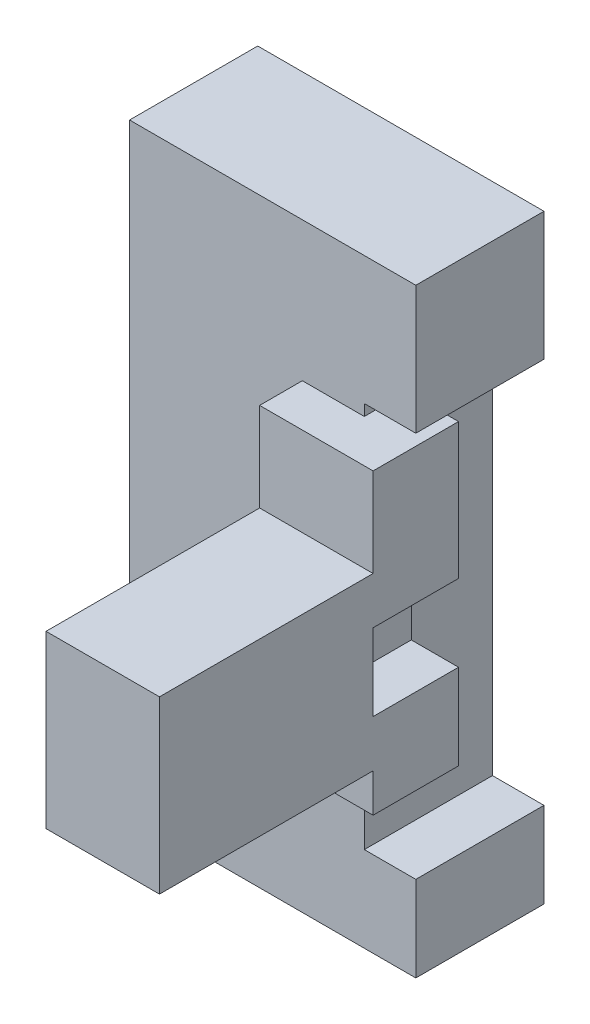
from build123d import *

# Parameters (mm, degrees)
SALIENTE_EXTRUIR1_DEPTH      = 2
CROQUIS2_W                   = 2.5
CROQUIS2_H                   = 4
SALIENTE_EXTRUIR2_DEPTH      = 5
SALIENTE_EXTRUIR3_DEPTH      = 2
SALIENTE_EXTRUIR3_DEPTH_BACK = 1
SALIENTE_EXTRUIR4_DEPTH      = 0.55
CROQUIS5_W                   = 3
CROQUIS5_H                   = 14.043254121
SALIENTE_EXTRUIR5_DEPTH      = 1.7


with BuildPart() as part:
    # Croquis1 → Saliente-Extruir1 (new body)
    with BuildSketch(Plane.XY):
        Polygon((44.714751496, -7.621064437), (44.114751496, -7.621064437), (44.114751496, -5.821064437), (45.220609876, -5.821064437), (45.220609876, -4.641064437), (45.220609876, -2.641064437), (43.114751496, -2.641064437), (43.114751496, -9.621064437), (44.114751496, -9.621064437), (45.220609876, -9.621064437), (45.220609876, -7.621064437), align=None)
    extrude(amount=SALIENTE_EXTRUIR1_DEPTH)

    # Croquis2 → Saliente-Extruir2 (add)
    with BuildSketch(Plane.XY.offset(2)):
        with Locations((43.970609876, -6.721064437)):
            Rectangle(CROQUIS2_W, CROQUIS2_H)
    extrude(amount=SALIENTE_EXTRUIR2_DEPTH)

    # Croquis3 → Saliente-Extruir3 (add, two sides: drawn at the far end of the back side and taken through both)
    with BuildSketch(Plane(origin=(0, 0, 0), x_dir=(-1, 0, 0), z_dir=(0, 0, -1)).offset(-SALIENTE_EXTRUIR3_DEPTH_BACK)):
        Polygon((-44.014751496, -2.37771269), (-44.014751496, -9.420966811), (-44.014751496, -11.420966811), (-45.220609876, -11.420966811), (-45.220609876, -13.420966811), (-40.220609876, -13.420966811), (-40.220609876, -12.420966811), (-40.220609876, 0.62228731), (-45.220609876, 0.62228731), (-45.220609876, -2.37771269), align=None)
    extrude(amount=SALIENTE_EXTRUIR3_DEPTH + SALIENTE_EXTRUIR3_DEPTH_BACK)

    # Croquis4 → Saliente-Extruir4 (add)
    with BuildSketch(Plane.ZY.offset(-43.114751496)):
        Polygon((1, -2.641064437), (2, -2.641064437), (2, -4.721064437), (7, -4.721064437), (7, -8.721064437), (2, -8.721064437), (2, -9.621064437), (1, -9.621064437), align=None)
    extrude(amount=SALIENTE_EXTRUIR4_DEPTH)

    # Croquis5 → Saliente-Extruir5 (add)
    with BuildSketch(Plane.ZY.offset(-40.220609876)):
        with Locations((-0.5, -6.399339751)):
            Rectangle(CROQUIS5_W, CROQUIS5_H)
    extrude(amount=SALIENTE_EXTRUIR5_DEPTH)


solid = part.part
